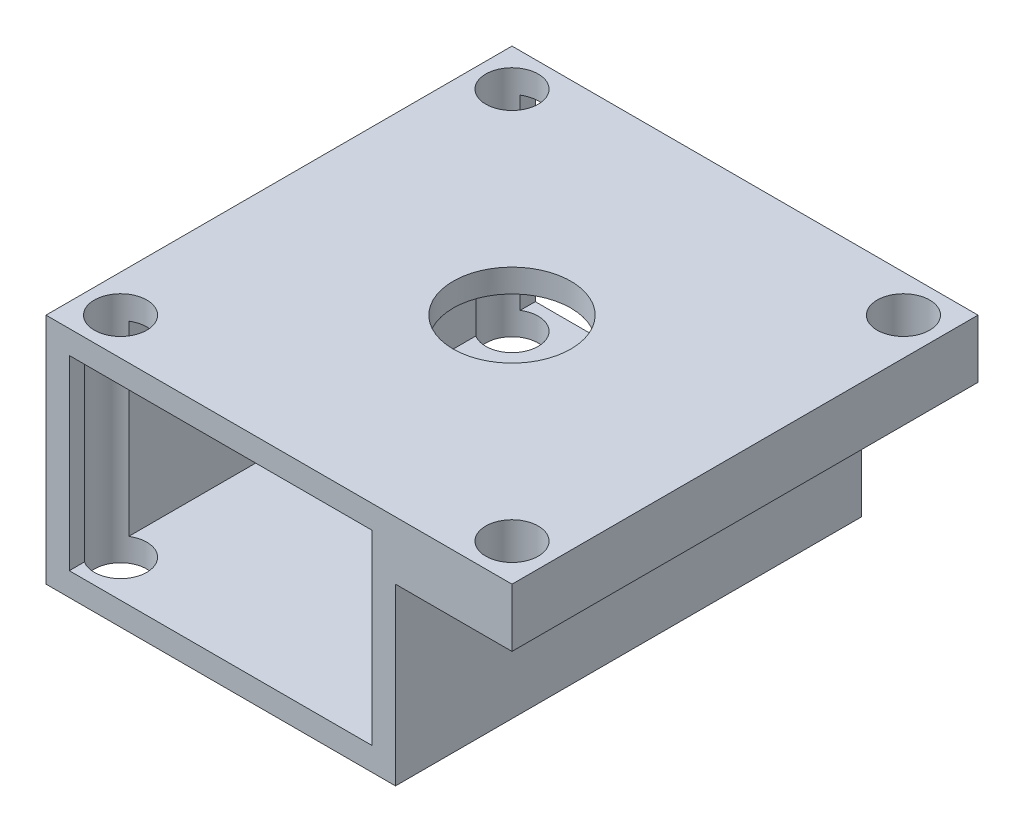
from build123d import *

# Parameters (mm, degrees)
SKETCH2_W           = 38.1
SKETCH2_H           = 50.8
BOSS_EXTRUDE1_DEPTH = 25.4
SHELL1_T            = -2.54
SKETCH3_W           = 50.8
SKETCH3_H           = 6.35
BOSS_EXTRUDE2_DEPTH = 12.7
SKETCH4_R           = 6.4135
SKETCH4_R_2         = 2.8575
CUT_EXTRUDE1_DEPTH  = 77.2


with BuildPart() as part:
    # Sketch2 → Boss-Extrude1 (new body)
    with BuildSketch(Plane(origin=(0, 0, 0), x_dir=(1, 0, 0), z_dir=(0, 1, 0))):
        with Locations((19.05, 25.4)):
            Rectangle(SKETCH2_W, SKETCH2_H)
    extrude(amount=BOSS_EXTRUDE1_DEPTH)

    # Shell1
    shell1_openings = [part.faces().sort_by_distance(p)[0] for p in [
        (19.05, 12.7, -50.8),
        (19.05, 12.7, 0),
    ]]
    offset(amount=SHELL1_T, openings=shell1_openings, kind=Kind.INTERSECTION)

    # Sketch3 → Boss-Extrude2 (add)
    with BuildSketch(Plane(origin=(38.1, 0, 0), x_dir=(0, 0, -1), z_dir=(1, 0, 0))):
        with Locations((25.4, 22.225)):
            Rectangle(SKETCH3_W, SKETCH3_H)
    extrude(amount=BOSS_EXTRUDE2_DEPTH)

    # Sketch4 → Cut-Extrude1 (cut, through all)
    with BuildSketch(Plane(origin=(0, 25.4, 0), x_dir=(1, 0, 0), z_dir=(0, 1, 0))):
        with Locations((25.4, 25.4)):
            Circle(SKETCH4_R)
        with Locations((4.064, 46.736)):
            Circle(SKETCH4_R_2)
        with Locations((46.736, 46.736)):
            Circle(SKETCH4_R_2)
        with Locations((46.736, 4.064)):
            Circle(SKETCH4_R_2)
        with Locations((4.064, 4.064)):
            Circle(SKETCH4_R_2)
    extrude(amount=-CUT_EXTRUDE1_DEPTH, mode=Mode.SUBTRACT)


solid = part.part
